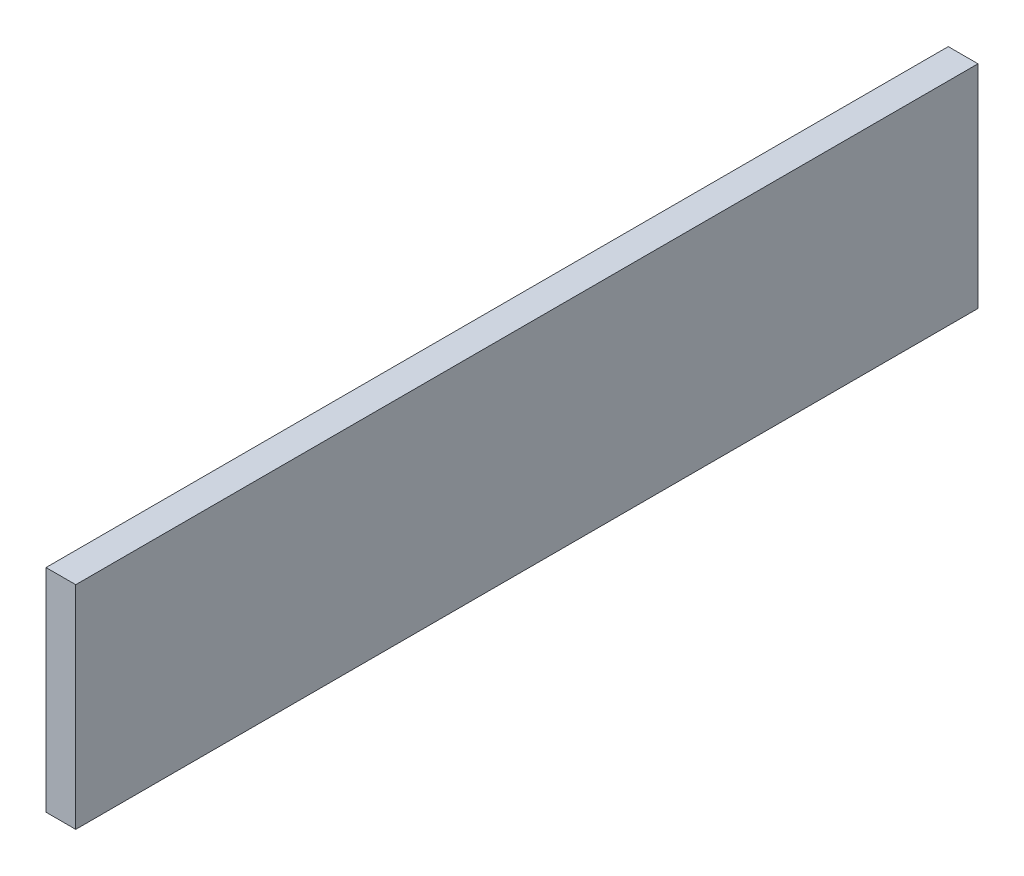
from build123d import *

# Parameters (mm, degrees)
SKETCH1_W           = 76.2
SKETCH1_H           = 2311.4
BOSS_EXTRUDE1_DEPTH = 542.925


with BuildPart() as part:
    # Sketch1 → Boss-Extrude1 (new body)
    with BuildSketch(Plane(origin=(0, 0, 0), x_dir=(1, 0, 0), z_dir=(0, 1, 0))):
        with Locations((38.1, 1155.7)):
            Rectangle(SKETCH1_W, SKETCH1_H)
    extrude(amount=BOSS_EXTRUDE1_DEPTH)


solid = part.part
